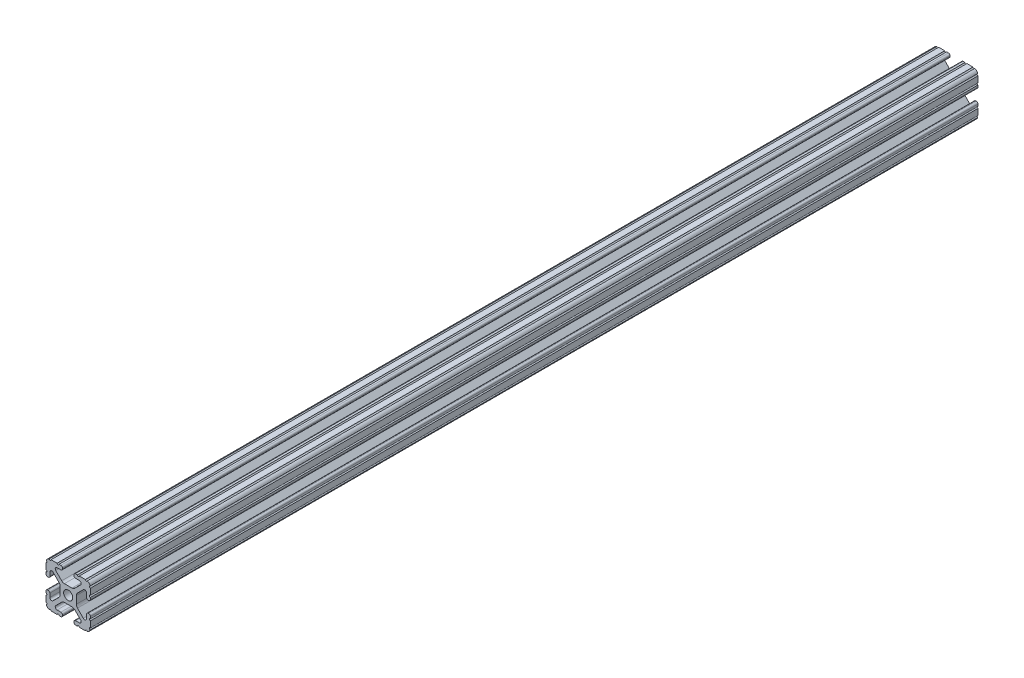
from build123d import *

# Parameters (mm, degrees)
BOSS_EXTRUDE1_DEPTH     = 1524
CUT_EXTRUDE1_DEPTH      = 1525.105829659
CUT_EXTRUDE1_DEPTH_BACK = 1525.105829659
SKETCH5_R               = 0.55245
CUT_EXTRUDE2_DEPTH      = 1525.105829659
CUT_EXTRUDE2_DEPTH_BACK = 1525.105829659
SKETCH8_W               = 50.559993734
SKETCH8_H               = 2552.7


with BuildPart() as part:
    # Sketch4 → Boss-Extrude1 (new, symmetric)
    with BuildSketch(Plane.XY):
        with BuildLine():
            Line((4.190365, -12.7), (10.11729625, -12.7))
            ThreePointArc((10.11729625, -12.7), (11.943543585, -11.943543585), (12.7, -10.11729625))
            Line((12.7, -10.11729625), (12.7, -4.190365))
            ThreePointArc((12.7, -4.190365), (12.42492494, -3.52627506), (11.760835, -3.2512))
            Line((11.760835, -3.2512), (11.429365, -3.2512))
            ThreePointArc((11.429365, -3.2512), (10.76527506, -3.52627506), (10.4902, -4.190365))
            Line((10.4902, -4.190365), (10.4902, -6.348478019))
            ThreePointArc((10.4902, -6.348478019), (9.830707141, -7.335478831), (8.666460301, -7.103895736))
            Line((8.666460301, -7.103895736), (5.299899128, -3.737334563))
            ThreePointArc((5.299899128, -3.737334563), (4.817571085, -3.015479634), (4.6482, -2.16399369))
            Line((4.6482, -2.16399369), (4.6482, 0))
            Line((4.6482, 0), (2.6035, 0))
            ThreePointArc((2.6035, 0), (1.840952505, -1.840952505), (0, -2.6035))
            Line((0, -2.6035), (0, -4.6482))
            Line((0, -4.6482), (2.16399369, -4.6482))
            ThreePointArc((2.16399369, -4.6482), (3.015479634, -4.817571085), (3.737334563, -5.299899128))
            Line((3.737334563, -5.299899128), (7.103895736, -8.666460301))
            ThreePointArc((7.103895736, -8.666460301), (7.335478831, -9.830707141), (6.348478019, -10.4902))
            Line((6.348478019, -10.4902), (4.190365, -10.4902))
            ThreePointArc((4.190365, -10.4902), (3.52627506, -10.76527506), (3.2512, -11.429365))
            Line((3.2512, -11.429365), (3.2512, -11.760835))
            ThreePointArc((3.2512, -11.760835), (3.52627506, -12.42492494), (4.190365, -12.7))
        make_face()
    extrude(amount=BOSS_EXTRUDE1_DEPTH, both=True)

    # Sketch5 → Cut-Extrude1 (cut, two sides: drawn at the far end of the back side and taken through both)
    with BuildSketch(Plane.XY.offset(-CUT_EXTRUDE1_DEPTH_BACK)):
        with Locations((10.356153152, -12.7)):
            Circle(SKETCH5_R)
        with Locations((5.796028019, -12.7)):
            Circle(SKETCH5_R)
        with Locations((12.7, -10.356153152)):
            Circle(SKETCH5_R)
        with Locations((12.7, -5.796028019)):
            Circle(SKETCH5_R)
    extrude(amount=CUT_EXTRUDE1_DEPTH + CUT_EXTRUDE1_DEPTH_BACK, mode=Mode.SUBTRACT)

    # Mirror1: part across plane


with BuildPart() as part_1:
    add(part.part)
    add(part.part.mirror(Plane(origin=(0, 0, 0), x_dir=(0, 0, 1), z_dir=(1, 0, 0))))

    # Mirror2: part across plane


with BuildPart() as part_2:
    add(part_1.part)
    add(part_1.part.mirror(Plane.ZX))

    # Sketch8 → Cut-Extrude2 (cut, two sides: drawn at the far end of the back side and taken through both)
    with BuildSketch(Plane(origin=(0, 0, 0), x_dir=(1, 0, 0), z_dir=(0, 1, 0)).offset(-CUT_EXTRUDE2_DEPTH_BACK)):
        with Locations((0, 260.35)):
            Rectangle(SKETCH8_W, SKETCH8_H)
    extrude(amount=CUT_EXTRUDE2_DEPTH + CUT_EXTRUDE2_DEPTH_BACK, mode=Mode.SUBTRACT)


solid = part_2.part
